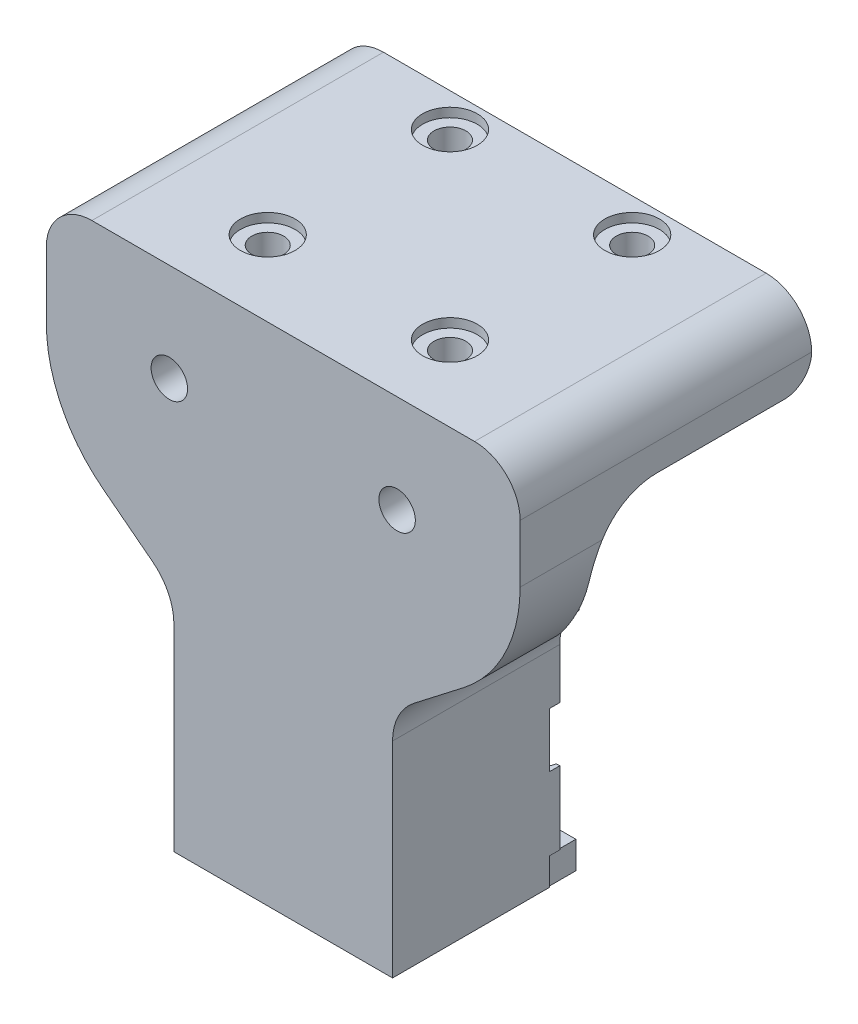
from build123d import *

# Parameters (mm, degrees)
BOSS_EXTRUDE1_DEPTH      = 24
BOSS_EXTRUDE1_DEPTH_BACK = 24
BOSS_EXTRUDE2_DEPTH      = 12.25
BOSS_EXTRUDE5_DEPTH      = 22
LPATTERN1_COUNT          = 18
LPATTERN1_PITCH          = 2
CUT_EXTRUDE11_REACH      = 64.879
CUT_EXTRUDE12_DEPTH      = 1.103071
SKETCH20_R               = 1.9999999999892617
SKETCH20_R_2             = 1.99999999998926
CUT_EXTRUDE13_DEPTH      = 12
BOSS_EXTRUDE7_DEPTH      = 2
BOSS_EXTRUDE7_DEPTH_BACK = 50
CUT_EXTRUDE16_DEPTH      = 64.66955708971128
CUT_EXTRUDE16_DEPTH_BACK = 14.25
CUT_EXTRUDE17_DEPTH      = 64.66955708971128
CUT_EXTRUDE17_DEPTH_BACK = 64.66955708971128
BOSS_EXTRUDE6_DEPTH      = 3
CUT_EXTRUDE5_REACH       = 71.139
SKETCH7_R                = 1.7500000000000038
SKETCH7_R_2              = 1.7499999999999998
SKETCH7_R_3              = 1.7500000000000004
CUT_EXTRUDE10_REACH      = 69.803
SKETCH14_R               = 2.0000000000000013
SKETCH14_R_2             = 1.9999999999999996
SKETCH8_R                = 3.0000000000000036
SKETCH8_R_2              = 2.9999999999999973
SKETCH8_R_3              = 2.9999999999999996
SKETCH8_R_4              = 2.999999999999999
CUT_EXTRUDE6_DEPTH       = 1
MIRROR2_COPY_1_DEPTH     = 3
FILLET1_R                = 7
FILLET3_R                = 3
FILLET4_R                = 6
FILLET5_R                = 16
CHAMFER1_SIZE            = 13
CHAMFER1_SIZE2           = 4
FILLET6_R                = 4
FILLET7_R                = 5


with BuildPart() as part:
    # Sketch1 → Boss-Extrude1 (new, two sides: drawn at the far end of the back side and taken through both)
    with BuildSketch(Plane(origin=(0, 0, 0), x_dir=(0, 0, -1), z_dir=(1, 0, 0)).offset(-BOSS_EXTRUDE1_DEPTH_BACK)):
        Polygon((0, 0), (1.995e-14, -55.500000000000014), (5.00000000000002, -55.500000000000014), (4.999999999999998, -4.999999999999999), (32.00000000000001, -5.000000000000005), (32.00000000000001, 0), align=None)
    extrude(amount=BOSS_EXTRUDE1_DEPTH + BOSS_EXTRUDE1_DEPTH_BACK)

    # Sketch2 → Boss-Extrude2 (add)
    with BuildSketch(Plane(origin=(0, 2.15e-15, -4.9999999999999964), x_dir=(-1, 0, 0), z_dir=(0, 4.3e-16, -1))):
        Polygon((-24, -27.500000000000018), (23.999999999999996, -27.500000000000018), (24, -55.500000000000014), (-23.999999999999996, -55.500000000000014), align=None)
    extrude(amount=BOSS_EXTRUDE2_DEPTH)

    # Sketch17 → Boss-Extrude5 (add)
    with BuildSketch(Plane(origin=(0, -52.49999999999999, 0), x_dir=(-1, 0, 0), z_dir=(0, -1, 0))):
        with BuildLine():
            Line((-24, 18.353071476134375), (-23.740175425099135, 18.353071476134375))
            ThreePointArc((-23.740175425099135, 18.353071476134375), (-23.641268354089767, 18.31584288786779), (-23.591456891390553, 18.222636693525683))
            ThreePointArc((-23.591456891390553, 18.222636693525683), (-23.55761171434285, 18.065009322158293), (-23.498876404494386, 17.914869228943367))
            ThreePointArc((-23.498876404494386, 17.914869228943367), (-23, 17.603071476134375), (-22.501123595505614, 17.914869228943367))
            ThreePointArc((-22.501123595505614, 17.914869228943367), (-22.442388285657145, 18.065009322158293), (-22.408543108609443, 18.222636693525683))
            ThreePointArc((-22.408543108609443, 18.222636693525683), (-22.35873164591023, 18.31584288786779), (-22.25982457490086, 18.353071476134375))
            Line((-22.25982457490086, 18.353071476134375), (-22, 18.353071476134375))
            Line((-22, 18.353071476134375), (-21.99999999999136, 17.250000000000014))
            Line((-21.99999999999136, 17.250000000000014), (-24.00000000000091, 17.250000000000014))
            Line((-24.00000000000091, 17.250000000000014), (-24, 18.353071476134375))
        make_face()
    boss_extrude5 = extrude(amount=-BOSS_EXTRUDE5_DEPTH)

    # LPattern1: Boss-Extrude5 ×18
    with Locations(*[(-i * LPATTERN1_PITCH, 0, 0) for i in range(1, LPATTERN1_COUNT)]):
        add(boss_extrude5)

    # Sketch18 → Cut-Extrude11 (cut, up to next)
    with BuildSketch(Plane(origin=(0, 6.95e-15, -17.249999999999996), x_dir=(-1, 0, 0), z_dir=(0, 4.2e-16, -1)), mode=Mode.PRIVATE) as cut_extrude11_sk1:
        Polygon((-24, -38.49999999996326), (12.000000000000004, -38.499999999963265), (12.000000000000004, -44.49999999996325), (-24, -44.49999999996326), align=None)
    cut_extrude11_tool1 = extrude(cut_extrude11_sk1.sketch, amount=CUT_EXTRUDE11_REACH, mode=Mode.PRIVATE) & part.part
    add(cut_extrude11_tool1.solids().sort_by_distance((6, -41.5, -17.25))[0], mode=Mode.SUBTRACT)

    # Sketch19 → Cut-Extrude12 (cut)
    with BuildSketch(Plane(origin=(0, 6.95e-15, -17.249999999999996), x_dir=(-1, 0, 0), z_dir=(0, 0, -1))):
        Polygon((-3.000000000000002, -27.50000000000001), (2.999999999999998, -27.50000000000001), (3.0000000000000013, -55.50000000000001), (-2.9999999999999987, -55.50000000000001), align=None)
    extrude(amount=CUT_EXTRUDE12_DEPTH, mode=Mode.SUBTRACT)


with BuildPart() as cut_extrude12_kept_piece:
    # of the separate pieces the step leaves, the one the design keeps (cut_extrude12_pieces_kept)
    add(part.part.solids().sort_by_distance((24, 0, 0))[0])

    # Sketch20 → Cut-Extrude13 (cut)
    with BuildSketch(Plane(origin=(0, 6.95e-15, -17.249999999999996), x_dir=(-1, 0, 0), z_dir=(0, 4.2e-16, -1))):
        with Locations(Location((-7.000000000000003, -41.499999999963265, 0), (0, 0, 90))):
            Circle(SKETCH20_R)
        with Locations(Location((7.000000000000001, -41.499999999963265, 0), (0, 0, 90))):
            Circle(SKETCH20_R_2)
    extrude(amount=-CUT_EXTRUDE13_DEPTH, mode=Mode.SUBTRACT)

    # Sketch26 → Boss-Extrude7 (add, two sides: drawn at the far end of the back side and taken through both)
    with BuildSketch(Plane(origin=(24, 0, 0), x_dir=(0, 0, -1), z_dir=(1, 0, 0)).offset(-BOSS_EXTRUDE7_DEPTH_BACK)):
        Polygon((0, 0), (32.00000000000001, 0), (32.00000000000001, -5.000000000000005), (32.00000000000001, -8), (8.000000000000007, -8.000000000000004), (8.000000000000009, -24.500000000000007), (17.250000000000007, -27.500000000000007), (8.41e-15, -27.500000000000004), align=None)
    extrude(amount=BOSS_EXTRUDE7_DEPTH + BOSS_EXTRUDE7_DEPTH_BACK)

    # Sketch27 → Cut-Extrude16 (cut, two sides: drawn at the far end of the back side and taken through both)
    with BuildSketch(Plane(origin=(0, 6.95e-15, -17.249999999999996), x_dir=(-1, 0, 0), z_dir=(0, 4e-16, -1)).offset(-CUT_EXTRUDE16_DEPTH_BACK)):
        Polygon((-23.000000000000004, -5.000000000000013), (23.000000000000004, -5.000000000000013), (23, -19.000000000000014), (12.000000000008642, -27.500000000000014), (-12.000000000008642, -27.500000000000014), (-23, -19.000000000000014), align=None)
    extrude(amount=CUT_EXTRUDE16_DEPTH + CUT_EXTRUDE16_DEPTH_BACK, mode=Mode.SUBTRACT)

    # Sketch28 → Cut-Extrude17 (cut, two sides: drawn at the far end of the back side and taken through both)
    with BuildSketch(Plane(origin=(0, 6.95e-15, -17.249999999999996), x_dir=(-1, 0, 0), z_dir=(0, 4e-16, -1)).offset(-CUT_EXTRUDE17_DEPTH_BACK)):
        Polygon((26.000000000000004, -55.500000000000014), (26.000000000000004, -20.08261169207738), (12.000000000008642, -30.90079351026103), (12.000000000008646, -55.500000000000014), align=None)
        Polygon((-26, -55.500000000000014), (-12.000000000008646, -55.500000000000014), (-12.000000000008646, -30.027534322629467), (-26.000000000000004, -19.209352504445818), align=None)
    extrude(amount=CUT_EXTRUDE17_DEPTH + CUT_EXTRUDE17_DEPTH_BACK, mode=Mode.SUBTRACT)

    # Sketch22 → Boss-Extrude6 (add)
    with BuildSketch(Plane(origin=(0, 6.95e-15, -17.249999999999996), x_dir=(-1, 0, 0), z_dir=(0, 4e-16, -1))):
        Polygon((-3.0000000000000018, -30.5), (-3.0000000000000018, -27.500000000000014), (-11.870087712553891, -27.500000000000014), (-11.870087712553891, -30.5), (-9.000000000000005, -30.5), (-9.000000000000005, -28.499999999999996), (-5.0000000000000036, -28.499999999999996), (-5.0000000000000036, -30.5), align=None)
    boss_extrude6 = extrude(amount=BOSS_EXTRUDE6_DEPTH)

    # Sketch7 → Cut-Extrude5 (cut, up to next)
    with BuildSketch(Plane(origin=(0, 0, 0), x_dir=(1, 0, 0), z_dir=(0, 1, 0)), mode=Mode.PRIVATE) as cut_extrude5_sk1:
        with Locations(Location((9.999999999999998, 28.30000000000002, 0), (0, 0, 270))):
            Circle(SKETCH7_R)
    cut_extrude5_tool1 = extrude(cut_extrude5_sk1.sketch, amount=-CUT_EXTRUDE5_REACH, mode=Mode.PRIVATE) & cut_extrude12_kept_piece.part
    # Sketch7 → Cut-Extrude5 (cut, up to next)
    with BuildSketch(Plane(origin=(0, 0, 0), x_dir=(1, 0, 0), z_dir=(0, 1, 0)), mode=Mode.PRIVATE) as cut_extrude5_sk2:
        with Locations(Location((10, 8.300000000000022, 0), (0, 0, 270))):
            Circle(SKETCH7_R_2)
    cut_extrude5_tool2 = extrude(cut_extrude5_sk2.sketch, amount=-CUT_EXTRUDE5_REACH, mode=Mode.PRIVATE) & cut_extrude12_kept_piece.part
    # Sketch7 → Cut-Extrude5 (cut, up to next)
    with BuildSketch(Plane(origin=(0, 0, 0), x_dir=(1, 0, 0), z_dir=(0, 1, 0)), mode=Mode.PRIVATE) as cut_extrude5_sk3:
        with Locations(Location((-10.000000000000002, 8.30000000000002, 0), (0, 0, 270))):
            Circle(SKETCH7_R_2)
    cut_extrude5_tool3 = extrude(cut_extrude5_sk3.sketch, amount=-CUT_EXTRUDE5_REACH, mode=Mode.PRIVATE) & cut_extrude12_kept_piece.part
    # Sketch7 → Cut-Extrude5 (cut, up to next)
    with BuildSketch(Plane(origin=(0, 0, 0), x_dir=(1, 0, 0), z_dir=(0, 1, 0)), mode=Mode.PRIVATE) as cut_extrude5_sk4:
        with Locations(Location((-10.000000000000002, 28.30000000000002, 0), (0, 0, 270))):
            Circle(SKETCH7_R_3)
    cut_extrude5_tool4 = extrude(cut_extrude5_sk4.sketch, amount=-CUT_EXTRUDE5_REACH, mode=Mode.PRIVATE) & cut_extrude12_kept_piece.part
    add(cut_extrude5_tool1.solids().sort_by_distance((10, 0, -28.3))[0], mode=Mode.SUBTRACT)
    add(cut_extrude5_tool2.solids().sort_by_distance((10, 0, -8.3))[0], mode=Mode.SUBTRACT)
    add(cut_extrude5_tool3.solids().sort_by_distance((-10, 0, -8.3))[0], mode=Mode.SUBTRACT)
    add(cut_extrude5_tool4.solids().sort_by_distance((-10, 0, -28.3))[0], mode=Mode.SUBTRACT)

    # Sketch14 → Cut-Extrude10 (cut, up to next)
    with BuildSketch(Plane(origin=(0, 1.08e-15, -3), x_dir=(-1, 0, 0), z_dir=(0, 3.6e-16, -1)), mode=Mode.PRIVATE) as cut_extrude10_sk1:
        with Locations(Location((-12.499999999999996, -10.75, 0), (0, 0, 90))):
            Circle(SKETCH14_R)
    cut_extrude10_tool1 = extrude(cut_extrude10_sk1.sketch, amount=-CUT_EXTRUDE10_REACH, mode=Mode.PRIVATE) & cut_extrude12_kept_piece.part
    # Sketch14 → Cut-Extrude10 (cut, up to next)
    with BuildSketch(Plane(origin=(0, 1.08e-15, -3), x_dir=(-1, 0, 0), z_dir=(0, 3.6e-16, -1)), mode=Mode.PRIVATE) as cut_extrude10_sk2:
        with Locations(Location((12.500000000000004, -10.75, 0), (0, 0, 90))):
            Circle(SKETCH14_R_2)
    cut_extrude10_tool2 = extrude(cut_extrude10_sk2.sketch, amount=-CUT_EXTRUDE10_REACH, mode=Mode.PRIVATE) & cut_extrude12_kept_piece.part
    add(cut_extrude10_tool1.solids().sort_by_distance((12.5, -10.75, -3))[0], mode=Mode.SUBTRACT)
    add(cut_extrude10_tool2.solids().sort_by_distance((-12.5, -10.75, -3))[0], mode=Mode.SUBTRACT)

    # Sketch8 → Cut-Extrude6 (cut)
    with BuildSketch(Plane(origin=(0, 0, 0), x_dir=(1, 0, 0), z_dir=(0, 1, 0))):
        with Locations(Location((9.999999999999998, 28.30000000000002, 0), (0, 0, 270))):
            Circle(SKETCH8_R)
        with Locations(Location((10, 8.300000000000022, 0), (0, 0, 270))):
            Circle(SKETCH8_R_2)
        with Locations(Location((-10.000000000000002, 8.30000000000002, 0), (0, 0, 270))):
            Circle(SKETCH8_R_3)
        with Locations(Location((-10.000000000000002, 28.30000000000002, 0), (0, 0, 270))):
            Circle(SKETCH8_R_4)
    extrude(amount=-CUT_EXTRUDE6_DEPTH, mode=Mode.SUBTRACT)

    # Mirror1: Boss-Extrude6 across plane
    add(boss_extrude6.mirror(Plane(origin=(0, 0, 0), x_dir=(0, 0, 1), z_dir=(1, 0, 0))))

    # Mirror2: Boss-Extrude6 across plane
    add(boss_extrude6.mirror(Plane(origin=(0, -41.49999999999999, 0), x_dir=(0, 0, 1), z_dir=(0, -1, 0))))

    # Mirror2 copy 1 sketch → Mirror2 copy 1 (add)
    with BuildSketch(Plane(origin=(0, -82.99999999999999, -17.249999999999996), x_dir=(1, 0, 0), z_dir=(0, -4e-16, -1))):
        Polygon((-3.0000000000000018, -30.5), (-3.0000000000000018, -27.500000000000014), (-11.870087712553891, -27.500000000000014), (-11.870087712553891, -30.5), (-9.000000000000005, -30.5), (-9.000000000000005, -28.499999999999996), (-5.0000000000000036, -28.499999999999996), (-5.0000000000000036, -30.5), align=None)
    extrude(amount=MIRROR2_COPY_1_DEPTH)

    # Fillet1
    # the kernel refuses this fillet: 7 mm, written as the material it adds along each edge
    with BuildSketch(Plane(origin=(31.874975978051552, -24.500000000000007, -8.000000000000009), x_dir=(0, -0.3085046980374366, -0.9512228189487624), z_dir=(-1, 0, 0))) as fillet1_piece_1_section:
        with BuildLine():
            CenterArc((FILLET1_R * 0.726954072366, -FILLET1_R), FILLET1_R, 90.00000000000001, 72.03086025984298)
            Line((-FILLET1_R * 0.224268746582, -FILLET1_R * 0.691495301963), (0, 0))
            Line((0, 0), (FILLET1_R * 0.726954072366, 1.8e-16))
        make_face()
    fillet1_piece_1 = extrude(amount=28.7143193032799, mode=Mode.PRIVATE)
    fillet1_piece_1 = split(fillet1_piece_1, bisect_by=Plane(origin=(17.907496587609153, -22.935116273214213, -9.064164512236312), z_dir=(0.6114475010760663, -0.7912850013919347, 0)), keep=Keep.TOP, mode=Mode.PRIVATE)
    fillet1_piece_1 = split(fillet1_piece_1, bisect_by=Plane(origin=(19.130391589761288, -24.517686275998088, -9.064164512236312), z_dir=(-0.6114475010760666, 0.7912850013919344, 0)), keep=Keep.TOP, mode=Mode.PRIVATE)
    add(fillet1_piece_1)
    with BuildSketch(Plane(origin=(-3.1606566747716514, -24.500000000000007, -8.000000000000009), x_dir=(0, 1, 0), z_dir=(-1, 0, 0))) as fillet1_piece_2_section:
        with BuildLine():
            CenterArc((FILLET1_R * 0.726954072366, FILLET1_R), FILLET1_R, 197.969139740157, 72.030860259843)
            Line((-FILLET1_R * 0.224268746582, FILLET1_R * 0.691495301963), (0, 0))
            Line((0, 0), (FILLET1_R * 0.726954072366, 0))
        make_face()
    fillet1_piece_2 = extrude(amount=29.844419428449264, mode=Mode.PRIVATE)
    fillet1_piece_2 = split(fillet1_piece_2, bisect_by=Plane(origin=(-26, -23.73269643051182, -9.065908083071502), z_dir=(1, 0, 0)), keep=Keep.TOP, mode=Mode.PRIVATE)
    fillet1_piece_2 = split(fillet1_piece_2, bisect_by=Plane(origin=(-19.89670102267117, -24.79879726547155, -9.065908083071502), z_dir=(0.6114475010760664, 0.7912850013919346, 0)), keep=Keep.TOP, mode=Mode.PRIVATE)
    fillet1_piece_2 = split(fillet1_piece_2, bisect_by=Plane(origin=(-18.251297694291, -22.66945178168712, -9.065908083071502), z_dir=(-0.6114475010760663, -0.7912850013919347, 0)), keep=Keep.TOP, mode=Mode.PRIVATE)
    add(fillet1_piece_2)
    with BuildSketch(Plane(origin=(-23, -8.000000000000004, -8.000000000000007), x_dir=(0, 2.5e-16, -1), z_dir=(-1, 0, 0))) as fillet1_piece_3:
        with BuildLine():
            CenterArc((FILLET1_R, FILLET1_R), FILLET1_R, 180, 90)
            Line((0, FILLET1_R), (0, 0))
            Line((0, 0), (FILLET1_R, 0))
        make_face()
    extrude(amount=3)
    with BuildSketch(Plane(origin=(26, -8.000000000000004, -8.000000000000007), x_dir=(0, -1, 0), z_dir=(-1, 0, 0))) as fillet1_piece_4:
        with BuildLine():
            CenterArc((FILLET1_R, -FILLET1_R), FILLET1_R, 90, 90)
            Line((0, -FILLET1_R), (0, 0))
            Line((0, 0), (FILLET1_R, 0))
        make_face()
    extrude(amount=2.9999999999999964)

    # Fillet3
    fillet3_edges = [cut_extrude12_kept_piece.edges().sort_by_distance(p)[0] for p in [
        (-24.5, -8, -32.00000000000001),
        (24.5, -8, -32.00000000000001),
    ]]
    fillet(fillet3_edges, radius=FILLET3_R)

    # Fillet4
    # the kernel refuses this fillet: 6 mm, written as the material it adds along each edge
    with BuildSketch(Plane(origin=(12.000000000008646, -30.027534322629467, -1.421e-14), x_dir=(0.7912850013917657, 0.6114475010762848, 0), z_dir=(0, 3.8e-16, -1))) as fillet4_piece_1_section:
        with BuildLine():
            CenterArc((FILLET4_R * 0.491039888587, FILLET4_R), FILLET4_R, 217.69424046671855, 52.305759533302535)
            Line((-FILLET4_R * 0.300245112805, FILLET4_R * 0.388552498924), (0, 0))
            Line((0, 0), (FILLET4_R * 0.491039888587, 1e-16))
        make_face()
    fillet4_piece_1 = extrude(amount=17.25, mode=Mode.PRIVATE)
    fillet4_piece_1 = split(fillet4_piece_1, bisect_by=Plane(origin=(12.754677082748323, -30.499999999999993, -8.624999999999975), z_dir=(0, 1, 0)), keep=Keep.TOP, mode=Mode.PRIVATE)
    add(fillet4_piece_1)
    with BuildSketch(Plane(origin=(12.000000000008646, -30.027534322629467, -1.421e-14), x_dir=(0.7912850013917657, 0.6114475010762848, 0), z_dir=(0, 3.8e-16, -1))) as fillet4_piece_2_section:
        with BuildLine():
            CenterArc((FILLET4_R * 0.491039888587, FILLET4_R), FILLET4_R, 217.69424046671855, 52.305759533302535)
            Line((-FILLET4_R * 0.300245112805, FILLET4_R * 0.388552498924), (0, 0))
            Line((0, 0), (FILLET4_R * 0.491039888587, 1e-16))
        make_face()
    fillet4_piece_2 = extrude(amount=17.25, mode=Mode.PRIVATE)
    fillet4_piece_2 = split(fillet4_piece_2, bisect_by=Plane(origin=(12.069684759154804, -30.499999999999993, -8.624999999999178), z_dir=(0, -1, 0)), keep=Keep.TOP, mode=Mode.PRIVATE)
    add(fillet4_piece_2)
    with BuildSketch(Plane(origin=(12.000000000008646, -30.027534322629467, -1.421e-14), x_dir=(0.7912850013917657, 0.6114475010762848, 0), z_dir=(0, 3.8e-16, -1))) as fillet4_piece_3_section:
        with BuildLine():
            CenterArc((FILLET4_R * 0.491039888587, FILLET4_R), FILLET4_R, 217.69424046671855, 52.305759533302535)
            Line((-FILLET4_R * 0.300245112805, FILLET4_R * 0.388552498924), (0, 0))
            Line((0, 0), (FILLET4_R * 0.491039888587, 1e-16))
        make_face()
    fillet4_piece_3 = extrude(amount=24.615598328803486, mode=Mode.PRIVATE)
    fillet4_piece_3 = split(fillet4_piece_3, bisect_by=Plane(origin=(12.06968475915482, -31.367007407617475, -17.25000000000001), z_dir=(0, 4.3e-16, -1)), keep=Keep.TOP, mode=Mode.PRIVATE)
    fillet4_piece_3 = split(fillet4_piece_3, bisect_by=Plane(origin=(12.06968475915482, -30.499999999999993, -17.80153573806719), z_dir=(0, -1, 0)), keep=Keep.TOP, mode=Mode.PRIVATE)
    fillet4_piece_3 = split(fillet4_piece_3, bisect_by=Plane(origin=(12.06968475915482, -31.367007407617475, -18.353071476134375), z_dir=(0, 0, 1)), keep=Keep.TOP, mode=Mode.PRIVATE)
    add(fillet4_piece_3)
    with BuildSketch(Plane(origin=(-12.000000000008642, -30.90079351026103, -1.421e-14), x_dir=(-0.791285001391851, 0.6114475010761745, 0), z_dir=(0, 3.8e-16, -1))) as fillet4_piece_4:
        with BuildLine():
            CenterArc((FILLET4_R * 0.491039888587, -FILLET4_R), FILLET4_R, 89.99999999998688, 52.30575953329942)
            Line((-FILLET4_R * 0.300245112805, -FILLET4_R * 0.388552498924), (0, 0))
            Line((0, 0), (FILLET4_R * 0.491039888587, -1e-16))
        make_face()
    extrude(amount=17.25)

    # Fillet5
    fillet5_edges = [cut_extrude12_kept_piece.edges().sort_by_distance(p)[0] for p in [
        (-23, -19.000000000000014, -5.500000000000014),
        (23, -19.000000000000014, -5.500000000000007),
    ]]
    fillet(fillet5_edges, radius=FILLET5_R)
    fillet5_2_edges = [cut_extrude12_kept_piece.edges().sort_by_distance(p)[0] for p in [
        (-26, -20.08261169207799, -4.0161311208223935),
        (26.000000000000004, -19.209352504445814, -4.000000000000014),
    ]]
    fillet(fillet5_2_edges, radius=FILLET5_R)

    # Chamfer1
    chamfer1_edges = [cut_extrude12_kept_piece.edges().sort_by_distance(p)[0] for p in [
        (0, -27.500000000000014, -3.0000000000000075),
    ]]
    chamfer1_side = [cut_extrude12_kept_piece.faces().sort_by_distance(p)[0] for p in [
        (-3e-16, -27.50000000000001, -11.286445341542326),
    ]]
    chamfer(chamfer1_edges, length=CHAMFER1_SIZE, length2=CHAMFER1_SIZE2, reference=chamfer1_side[0])

    # Fillet6
    fillet6_edges = [cut_extrude12_kept_piece.edges().sort_by_distance(p)[0] for p in [
        (0, -27.50000000000001, -16.000000000000007),
        (-9.592e-14, -23.500000000000014, -3.0000000000000053),
    ]]
    fillet(fillet6_edges, radius=FILLET6_R)

    # Fillet7
    fillet7_edges = [cut_extrude12_kept_piece.edges().sort_by_distance(p)[0] for p in [
        (26, 0, -16.000000000000004),
        (-26, 0, -16.000000000000004),
    ]]
    fillet(fillet7_edges, radius=FILLET7_R)


solid = cut_extrude12_kept_piece.part
